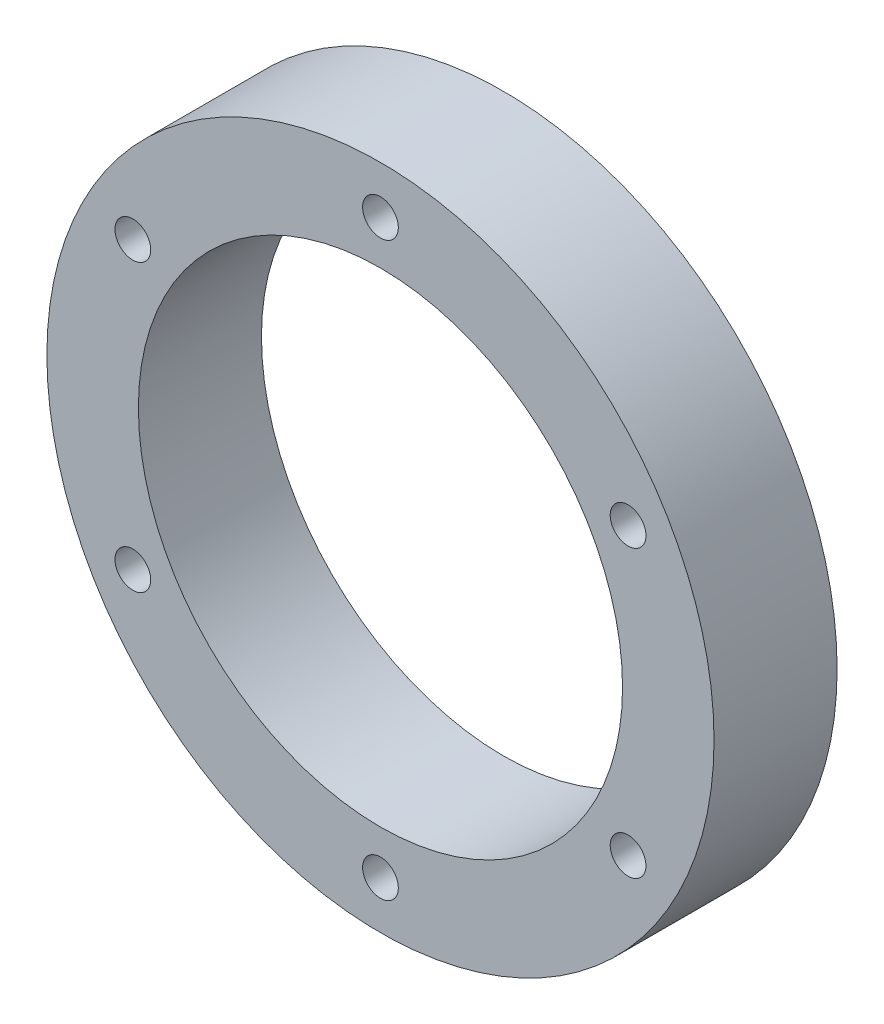
from build123d import *

# Parameters (mm, degrees)
SKETCH1_R           = 22.225
SKETCH1_R_2         = 16.129
BOSS_EXTRUDE1_DEPTH = 8.2
CIRPATTERN1_COUNT   = 6


with BuildPart() as part:
    # Sketch1 → Boss-Extrude1 (new body)
    with BuildSketch(Plane.XY):
        Circle(SKETCH1_R)
        Circle(SKETCH1_R_2, mode=Mode.SUBTRACT)
    extrude(amount=BOSS_EXTRUDE1_DEPTH)

    # Sketch2 → 3/32 (0.09375) Diameter Hole1 (revolve, cut)
    with BuildSketch(Plane(origin=(0, 19.05, 8.2), x_dir=(0, -1, 0), z_dir=(1, 0, 0))):
        Polygon((0, 0), (0, 26.115399675), (1.190625, 25.4), (1.190625, 0), align=None)
    f_3_32_0_09375_diameter_hole1 = revolve(axis=Axis((0, 19.05, 14.55), (0, 0, -1)), mode=Mode.SUBTRACT)

    # CirPattern1: 3/32 (0.09375) Diameter Hole1 ×6 about axis
    cirpattern1_axis = Axis((0, 0, 8.2), (0, 0, 1))
    for i in range(1, CIRPATTERN1_COUNT):
        add(f_3_32_0_09375_diameter_hole1.rotate(cirpattern1_axis, i * 360 / CIRPATTERN1_COUNT), mode=Mode.SUBTRACT)


solid = part.part
